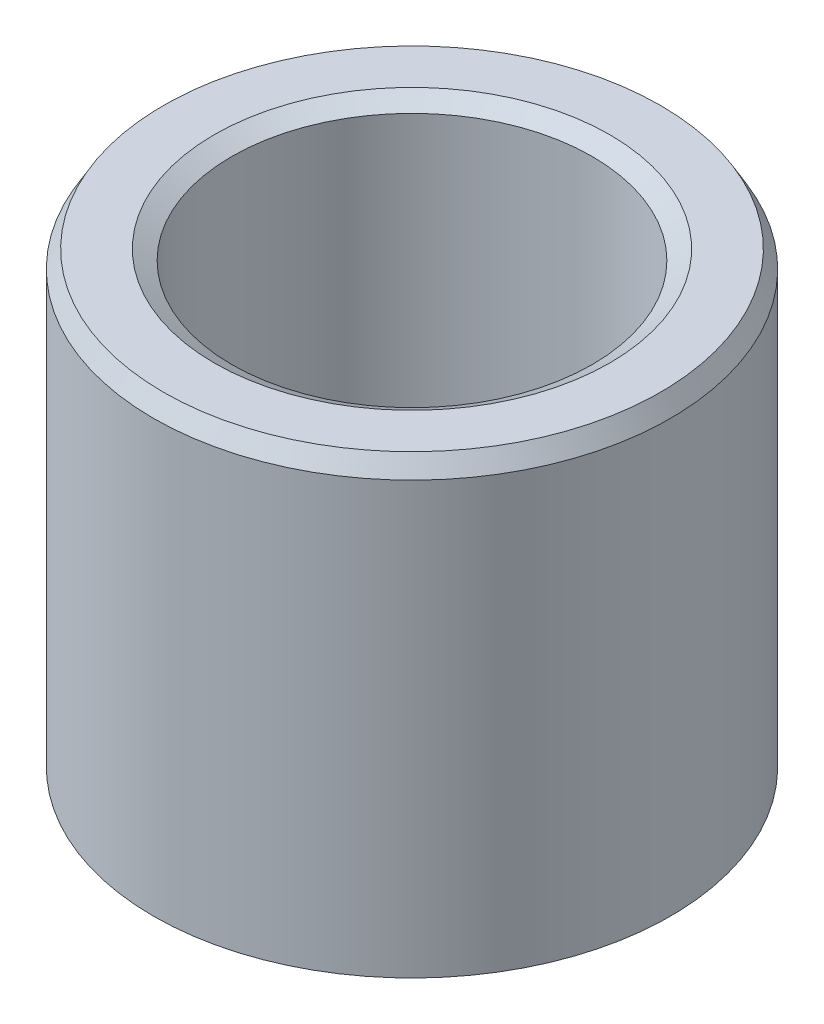
from build123d import *
from OCP.BRepFilletAPI import BRepFilletAPI_MakeChamfer

# Parameters (mm, degrees)
SKETCH1_R           = 42.5
BOSS_EXTRUDE1_DEPTH = 75.403098429
SKETCH2_R           = 29.626643948
CUT_EXTRUDE1_DEPTH  = 97.426797379
CHAMFER1_SIZE       = 2.877391854
CHAMFER1_SIZE2      = 1.661262961


with BuildPart() as part:
    # Sketch1 → Boss-Extrude1 (new body)
    with BuildSketch(Plane(origin=(0, 0, 0), x_dir=(1, 0, 0), z_dir=(0, 1, 0))):
        Circle(SKETCH1_R)
    extrude(amount=BOSS_EXTRUDE1_DEPTH)

    # Sketch2 → Cut-Extrude1 (cut, through all)
    with BuildSketch(Plane(origin=(0, 0, 0), x_dir=(1, 0, 0), z_dir=(0, 1, 0))):
        Circle(SKETCH2_R)
    extrude(amount=CUT_EXTRUDE1_DEPTH, mode=Mode.SUBTRACT)

    # Chamfer1: one chamfer whose edges measure the first distance from different faces: ONE call of the kernel's chamfer builder (chamfer() names one face for all edges)
    chamfer1_edges_1 = [part.edges().sort_by_distance(p)[0] for p in [
        (-29.626643948, 75.403098429, 0),
    ]]
    chamfer1_side_1 = [part.faces().sort_by_distance(p)[0] for p in [
        (-41.297918472, 75.403098429, 0),
    ]]
    chamfer1_edges_2 = [part.edges().sort_by_distance(p)[0] for p in [
        (-29.626643948, 0, 0),
    ]]
    chamfer1_side_2 = [part.faces().sort_by_distance(p)[0] for p in [
        (-29.626643948, 37.701549215, 0),
    ]]
    chamfer1_edges_3 = [part.edges().sort_by_distance(p)[0] for p in [
        (-42.5, 0, 0),
    ]]
    chamfer1_side_3 = [part.faces().sort_by_distance(p)[0] for p in [
        (-41.297918472, 0, 0),
    ]]
    chamfer1_edges_4 = [part.edges().sort_by_distance(p)[0] for p in [
        (-42.5, 75.403098429, 0),
    ]]
    chamfer1_side_4 = [part.faces().sort_by_distance(p)[0] for p in [
        (-42.5, 37.701549215, 0),
    ]]
    chamfer1 = BRepFilletAPI_MakeChamfer(part.part.solid().wrapped)
    for e in chamfer1_edges_1:
        chamfer1.Add(CHAMFER1_SIZE, CHAMFER1_SIZE2, e.wrapped, chamfer1_side_1[0].wrapped)  # the first distance lies on this face
    for e in chamfer1_edges_2:
        chamfer1.Add(CHAMFER1_SIZE, CHAMFER1_SIZE2, e.wrapped, chamfer1_side_2[0].wrapped)  # the first distance lies on this face
    for e in chamfer1_edges_3:
        chamfer1.Add(CHAMFER1_SIZE, CHAMFER1_SIZE2, e.wrapped, chamfer1_side_3[0].wrapped)  # the first distance lies on this face
    for e in chamfer1_edges_4:
        chamfer1.Add(CHAMFER1_SIZE, CHAMFER1_SIZE2, e.wrapped, chamfer1_side_4[0].wrapped)  # the first distance lies on this face
    add(Compound.cast(chamfer1.Shape()), mode=Mode.REPLACE)


solid = part.part
